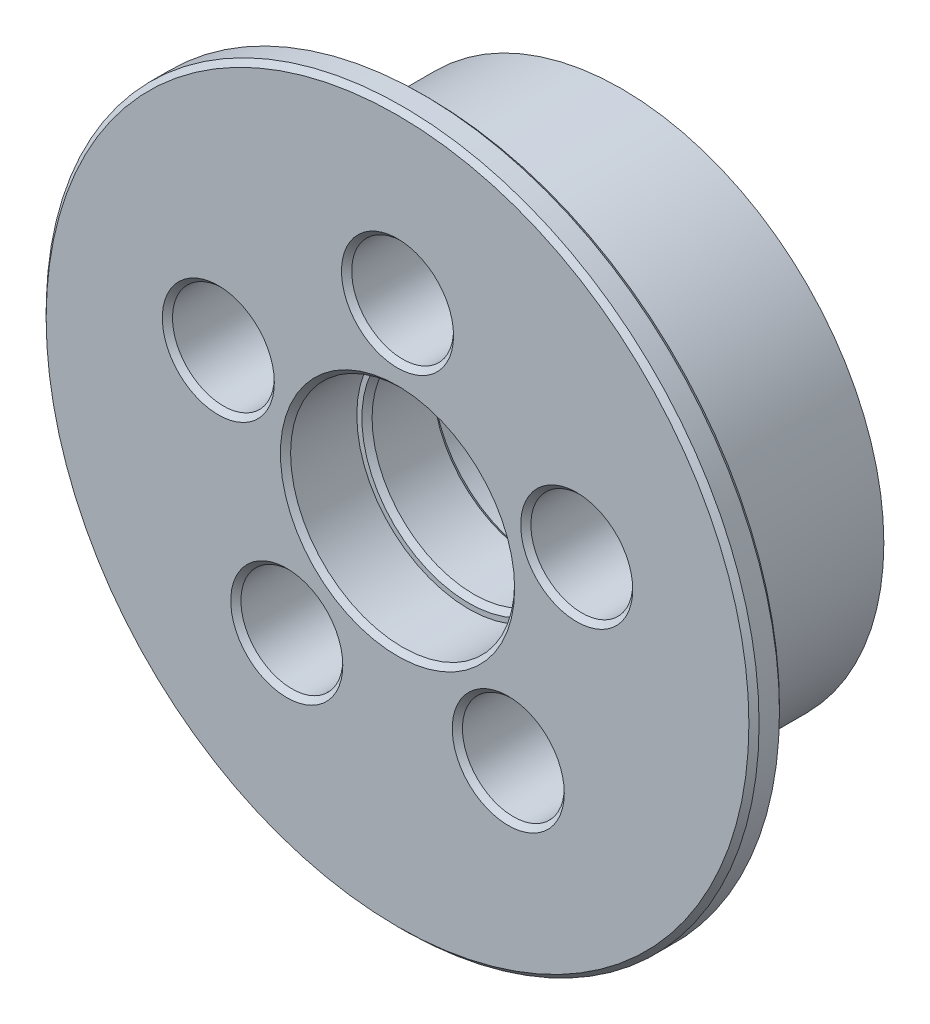
from build123d import *

# Parameters (mm, degrees)
SKETCH1_R           = 25.75
BOSS_EXTRUDE1_DEPTH = 19
SKETCH2_R           = 35
BOSS_EXTRUDE2_DEPTH = 3
SKETCH3_R           = 5
CUT_EXTRUDE1_DEPTH  = 55.166410256
SKETCH4_R           = 10
CUT_EXTRUDE2_DEPTH  = 55.166410256
SKETCH5_R           = 11
CUT_EXTRUDE3_DEPTH  = 8
CUT_EXTRUDE4_START  = -7
SKETCH6_R           = 11
CUT_EXTRUDE4_DEPTH  = 7
CHAMFER1_SIZE       = 0.5


with BuildPart() as part:
    # Sketch1 → Boss-Extrude1 (new body)
    with BuildSketch(Plane.XY):
        Circle(SKETCH1_R)
    extrude(amount=BOSS_EXTRUDE1_DEPTH)

    # Sketch2 → Boss-Extrude2 (add)
    with BuildSketch(Plane.XY.offset(19)):
        Circle(SKETCH2_R)
    extrude(amount=BOSS_EXTRUDE2_DEPTH)

    # Sketch3 → Cut-Extrude1 (cut, through all)
    with BuildSketch(Plane(origin=(0, 0, 0), x_dir=(-1, 0, 0), z_dir=(0, 0, -1))):
        with Locations((0, 18.5)):
            Circle(SKETCH3_R)
        with Locations((17.594545551, 5.716814396)):
            Circle(SKETCH3_R)
        with Locations((10.874027167, -14.966814396)):
            Circle(SKETCH3_R)
        with Locations((-10.874027167, -14.966814396)):
            Circle(SKETCH3_R)
        with Locations((-17.594545551, 5.716814396)):
            Circle(SKETCH3_R)
    extrude(amount=-CUT_EXTRUDE1_DEPTH, mode=Mode.SUBTRACT)

    # Sketch4 → Cut-Extrude2 (cut, through all)
    with BuildSketch(Plane(origin=(0, 0, 0), x_dir=(-1, 0, 0), z_dir=(0, 0, -1))):
        Circle(SKETCH4_R)
    extrude(amount=-CUT_EXTRUDE2_DEPTH, mode=Mode.SUBTRACT)

    # Sketch5 → Cut-Extrude3 (cut)
    with BuildSketch(Plane(origin=(0, 0, 0), x_dir=(-1, 0, 0), z_dir=(0, 0, -1))):
        Circle(SKETCH5_R)
    extrude(amount=-CUT_EXTRUDE3_DEPTH, mode=Mode.SUBTRACT)

    # Sketch6 → Cut-Extrude4 (cut)
    with BuildSketch(Plane.XY.offset(22).offset(CUT_EXTRUDE4_START)):
        Circle(SKETCH6_R)
    extrude(amount=CUT_EXTRUDE4_DEPTH, mode=Mode.SUBTRACT)

    # Chamfer1
    chamfer1_edges = [part.edges().sort_by_distance(p)[0] for p in [
        (-11, 0, 22),
        (-5.874027167, -14.966814396, 22),
        (15.874027167, -14.966814396, 22),
        (22.594545551, 5.716814396, 22),
        (5, 18.5, 22),
        (-12.594545551, 5.716814396, 22),
        (11, 0, 0),
        (5, 18.5, 0),
        (-12.594545551, 5.716814396, 0),
        (-5.874027167, -14.966814396, 0),
        (15.874027167, -14.966814396, 0),
        (22.594545551, 5.716814396, 0),
        (10, 0, 8),
        (10, 0, 15),
        (-35, 0, 22),
        (-35, 0, 19),
    ]]
    chamfer(chamfer1_edges, length=CHAMFER1_SIZE)


solid = part.part
